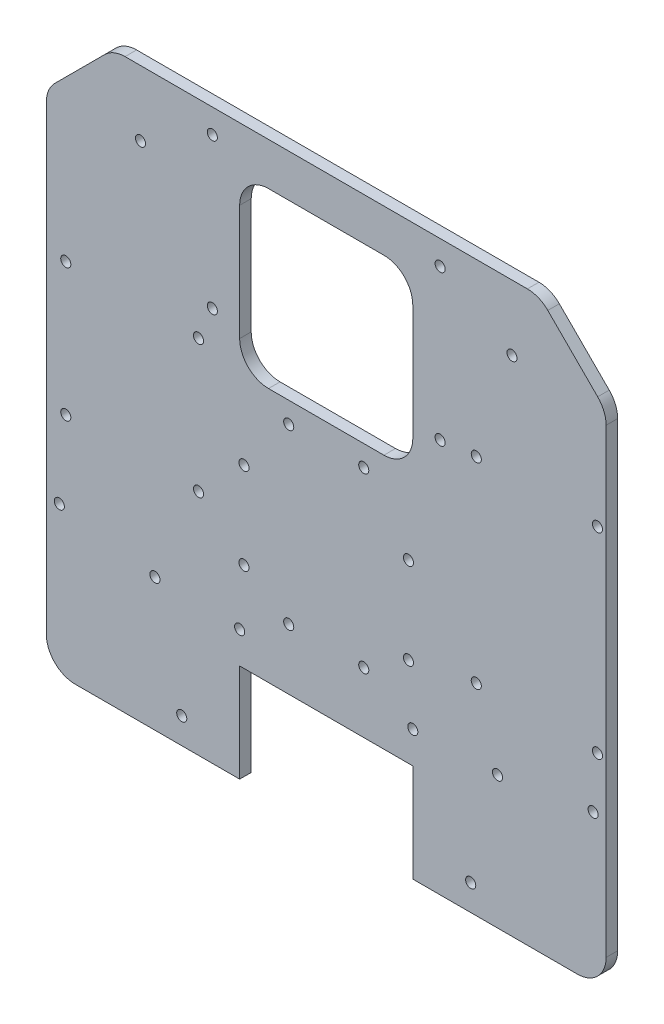
from build123d import *

# Parameters (mm, degrees)
EXTRUDE_1_DEPTH      = 4
SKETCH_6_R           = 1.75
CUT_EXTRUDE_3_DEPTH  = 4
SKETCH_4_R           = 1.75
CUT_EXTRUDE_4_DEPTH  = 4
SKETCH_7_R           = 1.75
CUT_EXTRUDE_5_DEPTH  = 4
SKETCH_8_R           = 1.75
CUT_EXTRUDE_6_DEPTH  = 4
CUT_EXTRUDE_7_DEPTH  = 4
SKETCH_10_R          = 1.75
SKETCH_10_R_2        = 1.749999998
CUT_EXTRUDE_9_DEPTH  = 4
CUT_EXTRUDE_10_REACH = 358.759
SKETCH_11_R          = 1.75
SKETCH_12_R          = 1.75
CUT_EXTRUDE_13_DEPTH = 357.758930869
SKETCH_13_W          = 60
SKETCH_13_H          = 33.978821531
CUT_EXTRUDE_14_DEPTH = 10
SKETCH_14_W          = 60
SKETCH_14_H          = 10
CUT_EXTRUDE_16_DEPTH = 10


with BuildPart() as part:
    # 草图3 → 凸台-拉伸1 (new body)
    with BuildSketch(Plane.XY):
        with BuildLine():
            Line((73.505746565, 259.089488009), (196.937204075, 259.089488009))
            ThreePointArc((196.937204075, 259.089488009), (204.590872722, 257.56707866), (211.079339699, 253.231623633))
            Line((211.079339699, 253.231623633), (239.363610944, 224.947352388))
            ThreePointArc((239.363610944, 224.947352388), (243.69906597, 218.458885412), (245.22147532, 210.805216764))
            Line((245.22147532, 210.805216764), (245.22147532, 54.089488009))
            ThreePointArc((245.22147532, 54.089488009), (239.363610944, 39.947352386), (225.22147532, 34.089488009))
            Line((225.22147532, 34.089488009), (45.221475318, 34.089488009))
            ThreePointArc((45.221475318, 34.089488009), (31.079339694, 39.947352386), (25.221475318, 54.089488009))
            Line((25.221475318, 54.089488009), (25.221475318, 210.805216762))
            ThreePointArc((25.221475318, 210.805216762), (26.743884667, 218.458885409), (31.079339694, 224.947352386))
            Line((31.079339694, 224.947352386), (59.363610941, 253.231623633))
            ThreePointArc((59.363610941, 253.231623633), (65.852077918, 257.56707866), (73.505746565, 259.089488009))
        make_face()
    extrude(amount=EXTRUDE_1_DEPTH)

    # 草图6 → 切除-拉伸3 (cut)
    with BuildSketch(Plane.XY.offset(4)):
        with Locations((187.22147532, 181.880072532)):
            Circle(SKETCH_6_R)
        with Locations((229.22147532, 181.880072532)):
            Circle(SKETCH_6_R)
        with Locations((229.22147532, 113.880072532)):
            Circle(SKETCH_6_R)
        with Locations((187.22147532, 113.880072532)):
            Circle(SKETCH_6_R)
    extrude(amount=-CUT_EXTRUDE_3_DEPTH, mode=Mode.SUBTRACT)

    # 草图4 → 切除-拉伸4 (cut)
    with BuildSketch(Plane.XY.offset(4)):
        with Locations((174.691475319, 232.74535793)):
            Circle(SKETCH_4_R)
        with Locations((174.691475319, 180.63535793)):
            Circle(SKETCH_4_R)
        with Locations((95.751475319, 180.63535793)):
            Circle(SKETCH_4_R)
        with Locations((95.751475319, 232.74535793)):
            Circle(SKETCH_4_R)
        with Locations((165.22147532, 89.06830954)):
            Circle(SKETCH_4_R)
        with Locations((105.22147532, 89.06830954)):
            Circle(SKETCH_4_R)
    extrude(amount=-CUT_EXTRUDE_4_DEPTH, mode=Mode.SUBTRACT)

    # 草图7 → 切除-拉伸5 (cut)
    with BuildSketch(Plane.XY.offset(4)):
        with Locations((122.221475319, 159.089488009)):
            Circle(SKETCH_7_R)
        with Locations((148.221475319, 159.089488009)):
            Circle(SKETCH_7_R)
        with Locations((122.221475319, 99.089488009)):
            Circle(SKETCH_7_R)
        with Locations((148.221475319, 99.089488009)):
            Circle(SKETCH_7_R)
    extrude(amount=-CUT_EXTRUDE_5_DEPTH, mode=Mode.SUBTRACT)

    # 草图8 → 切除-拉伸6 (cut)
    with BuildSketch(Plane.XY.offset(4)):
        with Locations((227.720064334, 95.494716411)):
            Circle(SKETCH_8_R)
        with Locations((185.293657462, 53.06830954)):
            Circle(SKETCH_8_R)
        with Locations((42.722886307, 95.494716411)):
            Circle(SKETCH_8_R)
        with Locations((85.149293178, 53.06830954)):
            Circle(SKETCH_8_R)
    extrude(amount=-CUT_EXTRUDE_6_DEPTH, mode=Mode.SUBTRACT)

    # 草图9 → 切除-拉伸7 (cut)
    with BuildSketch(Plane.XY.offset(4)):
        with BuildLine():
            ThreePointArc((105.22147532, 176.324698125), (108.150407508, 169.253630313), (115.22147532, 166.324698125))
            Line((115.22147532, 166.324698125), (155.22147532, 166.324698125))
            ThreePointArc((155.22147532, 166.324698125), (162.292543132, 169.253630313), (165.22147532, 176.324698125))
            Line((165.22147532, 176.324698125), (165.22147532, 216.324698125))
            ThreePointArc((165.22147532, 216.324698125), (162.292543132, 223.395765937), (155.22147532, 226.324698125))
            Line((155.22147532, 226.324698125), (135.22147532, 226.324698125))
            Line((135.22147532, 226.324698125), (115.22147532, 226.324698125))
            ThreePointArc((115.22147532, 226.324698125), (108.150407508, 223.395765937), (105.22147532, 216.324698125))
            Line((105.22147532, 216.324698125), (105.22147532, 196.104283633))
            Line((105.22147532, 196.104283633), (105.22147532, 176.324698125))
        make_face()
    extrude(amount=-CUT_EXTRUDE_7_DEPTH, mode=Mode.SUBTRACT)

    # 草图10 → 切除-拉伸9 (cut)
    with BuildSketch(Plane.XY.offset(4)):
        with Locations((106.721475319, 109.089488009)):
            Circle(SKETCH_10_R)
        with Locations((163.721475321, 109.089488009)):
            Circle(SKETCH_10_R_2)
        with Locations((106.721475319, 139.089488009)):
            Circle(SKETCH_10_R)
        with Locations((163.721475321, 139.089488009)):
            Circle(SKETCH_10_R)
    extrude(amount=-CUT_EXTRUDE_9_DEPTH, mode=Mode.SUBTRACT)

    # 草图11 → 切除-拉伸10 (cut, up to next)
    with BuildSketch(Plane.XY.offset(4), mode=Mode.PRIVATE) as cut_extrude_10_sk1:
        with Locations((70.852077918, 218.458885409)):
            Circle(SKETCH_11_R)
    cut_extrude_10_tool1 = extrude(cut_extrude_10_sk1.sketch, amount=-CUT_EXTRUDE_10_REACH, mode=Mode.PRIVATE) & part.part
    # 草图11 → 切除-拉伸10 (cut, up to next)
    with BuildSketch(Plane.XY.offset(4), mode=Mode.PRIVATE) as cut_extrude_10_sk2:
        with Locations((75.852077918, 90.084611013)):
            Circle(SKETCH_11_R)
    cut_extrude_10_tool2 = extrude(cut_extrude_10_sk2.sketch, amount=-CUT_EXTRUDE_10_REACH, mode=Mode.PRIVATE) & part.part
    # 草图11 → 切除-拉伸10 (cut, up to next)
    with BuildSketch(Plane.XY.offset(4), mode=Mode.PRIVATE) as cut_extrude_10_sk3:
        with Locations((194.590872722, 90.084611013)):
            Circle(SKETCH_11_R)
    cut_extrude_10_tool3 = extrude(cut_extrude_10_sk3.sketch, amount=-CUT_EXTRUDE_10_REACH, mode=Mode.PRIVATE) & part.part
    # 草图11 → 切除-拉伸10 (cut, up to next)
    with BuildSketch(Plane.XY.offset(4), mode=Mode.PRIVATE) as cut_extrude_10_sk4:
        with Locations((199.590872722, 218.458885409)):
            Circle(SKETCH_11_R)
    cut_extrude_10_tool4 = extrude(cut_extrude_10_sk4.sketch, amount=-CUT_EXTRUDE_10_REACH, mode=Mode.PRIVATE) & part.part
    add(cut_extrude_10_tool1.solids().sort_by_distance((70.852078, 218.458885, 4))[0], mode=Mode.SUBTRACT)
    add(cut_extrude_10_tool2.solids().sort_by_distance((75.852078, 90.084611, 4))[0], mode=Mode.SUBTRACT)
    add(cut_extrude_10_tool3.solids().sort_by_distance((194.590873, 90.084611, 4))[0], mode=Mode.SUBTRACT)
    add(cut_extrude_10_tool4.solids().sort_by_distance((199.590873, 218.458885, 4))[0], mode=Mode.SUBTRACT)

    # 草图12 → 切除-拉伸13 (cut, through all)
    with BuildSketch(Plane.XY.offset(4)):
        with Locations((90.961423691, 169.312171827)):
            Circle(SKETCH_12_R)
        with Locations((90.961423691, 123.312171827)):
            Circle(SKETCH_12_R)
        with Locations((44.961423691, 123.312171827)):
            Circle(SKETCH_12_R)
        with Locations((44.961423691, 169.312171827)):
            Circle(SKETCH_12_R)
    extrude(amount=-CUT_EXTRUDE_13_DEPTH, mode=Mode.SUBTRACT)

    # 草图13 → 切除-拉伸14 (cut)
    with BuildSketch(Plane.XY.offset(4)):
        with Locations((135.22147532, 51.078898775)):
            Rectangle(SKETCH_13_W, SKETCH_13_H)
    extrude(amount=-CUT_EXTRUDE_14_DEPTH, mode=Mode.SUBTRACT)

    # 草图14 → 切除-拉伸16 (cut)
    with BuildSketch(Plane.XY):
        with Locations((135.22147532, 73.06830954)):
            Rectangle(SKETCH_14_W, SKETCH_14_H)
        with BuildLine():
            Line((105.22147532, 34.089488009), (105.22147532, 44.089488009))
            Line((105.22147532, 44.089488009), (48.221475318, 44.089488009))
            ThreePointArc((48.221475318, 44.089488009), (41.150407506, 47.018420197), (38.221475318, 54.089488009))
            Line((38.221475318, 54.089488009), (38.221475318, 213.805216762))
            ThreePointArc((38.221475318, 213.805216762), (38.982679993, 217.632051085), (41.150407506, 220.876284574))
            Line((41.150407506, 220.876284574), (58.434678753, 238.160555821))
            ThreePointArc((58.434678753, 238.160555821), (61.678912242, 240.328283334), (65.505746565, 241.089488009))
            Line((65.505746565, 241.089488009), (204.937204075, 241.089488009))
            ThreePointArc((204.937204075, 241.089488009), (208.764038399, 240.328283334), (212.008271887, 238.160555821))
            Line((212.008271887, 238.160555821), (229.292543132, 220.876284576))
            ThreePointArc((229.292543132, 220.876284576), (231.460270645, 217.632051088), (232.22147532, 213.805216764))
            Line((232.22147532, 213.805216764), (232.22147532, 54.089488009))
            ThreePointArc((232.22147532, 54.089488009), (229.292543132, 47.018420197), (222.22147532, 44.089488009))
            Line((222.22147532, 44.089488009), (165.22147532, 44.089488009))
            Line((165.22147532, 44.089488009), (165.22147532, 34.089488009))
            Line((165.22147532, 34.089488009), (225.22147532, 34.089488009))
            ThreePointArc((225.22147532, 34.089488009), (239.363610944, 39.947352386), (245.22147532, 54.089488009))
            Line((245.22147532, 54.089488009), (245.22147532, 210.805216764))
            ThreePointArc((245.22147532, 210.805216764), (243.69906597, 218.458885412), (239.363610944, 224.947352388))
            Line((239.363610944, 224.947352388), (211.079339699, 253.231623633))
            ThreePointArc((211.079339699, 253.231623633), (204.590872722, 257.56707866), (196.937204075, 259.089488009))
            Line((196.937204075, 259.089488009), (73.505746565, 259.089488009))
            ThreePointArc((73.505746565, 259.089488009), (65.852077918, 257.56707866), (59.363610941, 253.231623633))
            Line((59.363610941, 253.231623633), (31.079339694, 224.947352386))
            ThreePointArc((31.079339694, 224.947352386), (26.743884667, 218.458885409), (25.221475318, 210.805216762))
            Line((25.221475318, 210.805216762), (25.221475318, 54.089488009))
            ThreePointArc((25.221475318, 54.089488009), (31.079339694, 39.947352386), (45.221475318, 34.089488009))
            Line((45.221475318, 34.089488009), (105.22147532, 34.089488009))
        make_face()
    extrude(amount=CUT_EXTRUDE_16_DEPTH, mode=Mode.SUBTRACT)


solid = part.part
